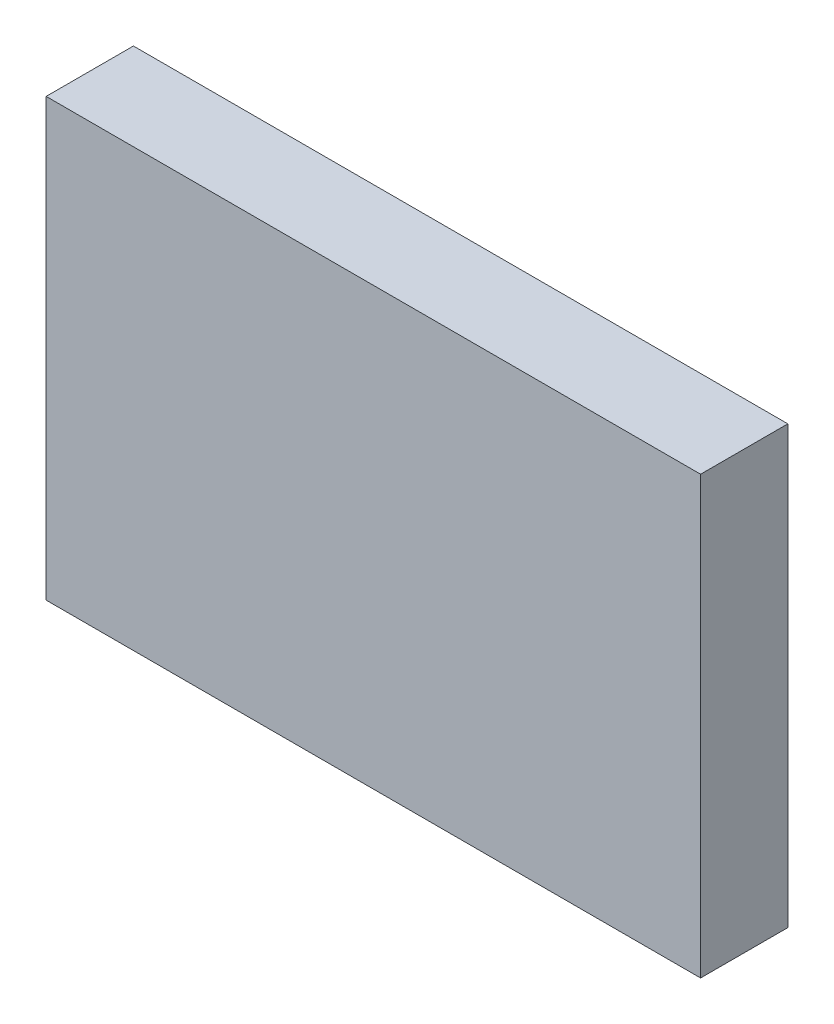
from build123d import *

# Parameters (mm, degrees)
SKETCH_1_W      = 30
SKETCH_1_H      = 20
EXTRUDE_1_DEPTH = 4


with BuildPart() as part:
    # Эскиз1 → Бобышка-Вытянуть1 (new body)
    with BuildSketch(Plane.XY):
        Rectangle(SKETCH_1_W, SKETCH_1_H)
    extrude(amount=EXTRUDE_1_DEPTH)


solid = part.part
